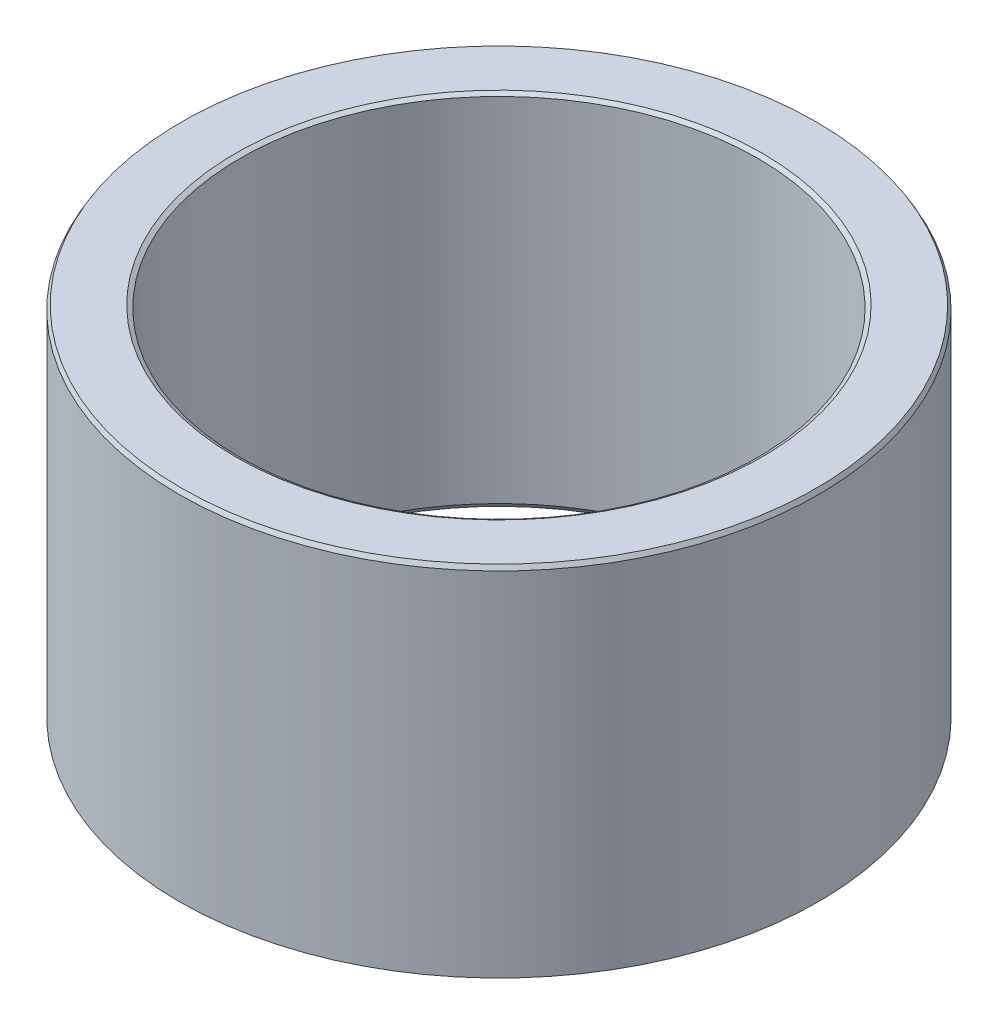
from build123d import *
from OCP.BRepFilletAPI import BRepFilletAPI_MakeChamfer

# Parameters (mm, degrees)
SKETCH1_R           = 30
BOSS_EXTRUDE1_DEPTH = 33.703167707
SKETCH2_R           = 24.29647146
CUT_EXTRUDE1_DEPTH  = 55.183978384
CHAMFER1_SIZE       = 0.396953254
CHAMFER1_SIZE2      = 0.229181068


with BuildPart() as part:
    # Sketch1 → Boss-Extrude1 (new body)
    with BuildSketch(Plane(origin=(0, 0, 0), x_dir=(1, 0, 0), z_dir=(0, 1, 0))):
        Circle(SKETCH1_R)
    extrude(amount=BOSS_EXTRUDE1_DEPTH)

    # Sketch2 → Cut-Extrude1 (cut, through all)
    with BuildSketch(Plane(origin=(0, 0, 0), x_dir=(1, 0, 0), z_dir=(0, 1, 0))):
        Circle(SKETCH2_R)
    extrude(amount=CUT_EXTRUDE1_DEPTH, mode=Mode.SUBTRACT)

    # Chamfer1: one chamfer whose edges measure the first distance from different faces: ONE call of the kernel's chamfer builder (chamfer() names one face for all edges)
    chamfer1_edges_1 = [part.edges().sort_by_distance(p)[0] for p in [
        (-24.29647146, 33.703167707, 0),
    ]]
    chamfer1_side_1 = [part.faces().sort_by_distance(p)[0] for p in [
        (-29.151471863, 33.703167707, 0),
    ]]
    chamfer1_edges_2 = [part.edges().sort_by_distance(p)[0] for p in [
        (-24.29647146, 0, 0),
    ]]
    chamfer1_side_2 = [part.faces().sort_by_distance(p)[0] for p in [
        (-24.29647146, 16.851583854, 0),
    ]]
    chamfer1_edges_3 = [part.edges().sort_by_distance(p)[0] for p in [
        (-30, 0, 0),
    ]]
    chamfer1_side_3 = [part.faces().sort_by_distance(p)[0] for p in [
        (-29.151471863, 0, 0),
    ]]
    chamfer1_edges_4 = [part.edges().sort_by_distance(p)[0] for p in [
        (-30, 33.703167707, 0),
    ]]
    chamfer1_side_4 = [part.faces().sort_by_distance(p)[0] for p in [
        (-30, 16.851583854, 0),
    ]]
    chamfer1 = BRepFilletAPI_MakeChamfer(part.part.solid().wrapped)
    for e in chamfer1_edges_1:
        chamfer1.Add(CHAMFER1_SIZE, CHAMFER1_SIZE2, e.wrapped, chamfer1_side_1[0].wrapped)  # the first distance lies on this face
    for e in chamfer1_edges_2:
        chamfer1.Add(CHAMFER1_SIZE, CHAMFER1_SIZE2, e.wrapped, chamfer1_side_2[0].wrapped)  # the first distance lies on this face
    for e in chamfer1_edges_3:
        chamfer1.Add(CHAMFER1_SIZE, CHAMFER1_SIZE2, e.wrapped, chamfer1_side_3[0].wrapped)  # the first distance lies on this face
    for e in chamfer1_edges_4:
        chamfer1.Add(CHAMFER1_SIZE, CHAMFER1_SIZE2, e.wrapped, chamfer1_side_4[0].wrapped)  # the first distance lies on this face
    add(Compound.cast(chamfer1.Shape()), mode=Mode.REPLACE)


solid = part.part
